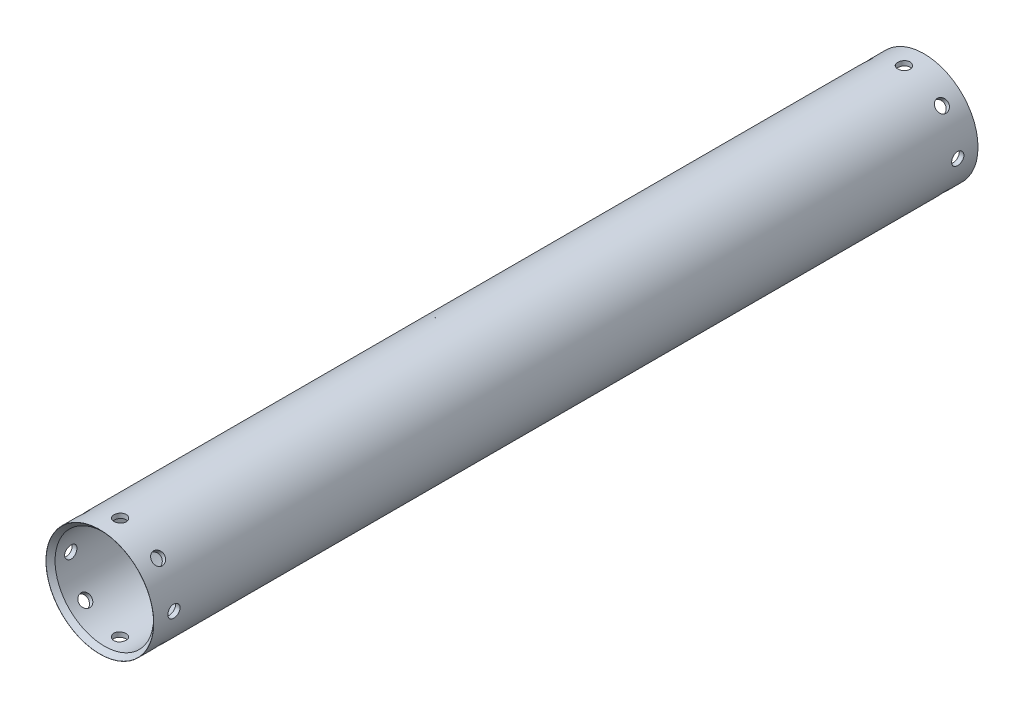
from build123d import *

# Parameters (mm, degrees)
SKETCH1_R               = 38.275
BOSS_EXTRUDE1_DEPTH     = 585
SKETCH2_R               = 34.975
CUT_EXTRUDE1_DEPTH      = 585
CUT_EXTRUDE2_DEPTH      = 588.49889468
CUT_EXTRUDE2_DEPTH_BACK = 588.49889468
SKETCH6_R               = 4.35
CUT_EXTRUDE3_DEPTH      = 588.498894792
CUT_EXTRUDE3_DEPTH_BACK = 588.498894792
SKETCH7_R               = 4.35
CUT_EXTRUDE4_DEPTH      = 588.498894792
CUT_EXTRUDE4_DEPTH_BACK = 588.498894792
SKETCH8_R               = 4.35
CUT_EXTRUDE5_DEPTH      = 588.498894792
CUT_EXTRUDE5_DEPTH_BACK = 588.498894792
SKETCH9_R               = 4.35
CUT_EXTRUDE6_DEPTH      = 593.25290528
CUT_EXTRUDE6_DEPTH_BACK = 593.25290528
SKETCH10_R              = 4.35
CUT_EXTRUDE7_DEPTH      = 593.25290528
CUT_EXTRUDE7_DEPTH_BACK = 593.25290528
SKETCH11_R              = 4.35
CUT_EXTRUDE8_DEPTH      = 585
CUT_EXTRUDE8_DEPTH_BACK = 585
SKETCH12_R              = 4.35
CUT_EXTRUDE9_DEPTH      = 585
CUT_EXTRUDE9_DEPTH_BACK = 585
SKETCH13_R              = 4.35
CHAMFER1_SIZE           = 3.2
CHAMFER2_SIZE           = 3.2


with BuildPart() as part:
    # Sketch1 → Boss-Extrude1 (new body)
    with BuildSketch(Plane.XY):
        Circle(SKETCH1_R)
    extrude(amount=BOSS_EXTRUDE1_DEPTH)

    # Sketch2 → Cut-Extrude1 (cut)
    with BuildSketch(Plane.XY.offset(585)):
        Circle(SKETCH2_R)
    extrude(amount=-CUT_EXTRUDE1_DEPTH, mode=Mode.SUBTRACT)

    # Sketch6 → Cut-Extrude2 (cut, two sides: drawn at the far end of the back side and taken through both)
    with BuildSketch(Plane(origin=(0, 0, 0), x_dir=(1, 0, 0), z_dir=(0, 1, 0)).offset(-CUT_EXTRUDE2_DEPTH_BACK)):
        with Locations((0, -570.65)):
            Circle(SKETCH6_R)
    extrude(amount=CUT_EXTRUDE2_DEPTH + CUT_EXTRUDE2_DEPTH_BACK, mode=Mode.SUBTRACT)

    # Sketch7 → Cut-Extrude3 (cut, two sides: drawn at the far end of the back side and taken through both)
    with BuildSketch(Plane(origin=(0, 0, 0), x_dir=(0, 0, -1), z_dir=(1, 0, 0)).offset(-CUT_EXTRUDE3_DEPTH_BACK)):
        with Locations((-570.65, 0)):
            Circle(SKETCH7_R)
    extrude(amount=CUT_EXTRUDE3_DEPTH + CUT_EXTRUDE3_DEPTH_BACK, mode=Mode.SUBTRACT)

    # Sketch8 → Cut-Extrude4 (cut, two sides: drawn at the far end of the back side and taken through both)
    with BuildSketch(Plane(origin=(0, 0, 0), x_dir=(0, 0, -1), z_dir=(1, 0, 0)).offset(-CUT_EXTRUDE4_DEPTH_BACK)):
        with Locations((-14.35, 0)):
            Circle(SKETCH8_R)
    extrude(amount=CUT_EXTRUDE4_DEPTH + CUT_EXTRUDE4_DEPTH_BACK, mode=Mode.SUBTRACT)

    # Sketch9 → Cut-Extrude5 (cut, two sides: drawn at the far end of the back side and taken through both)
    with BuildSketch(Plane(origin=(0, 0, 0), x_dir=(1, 0, 0), z_dir=(0, 1, 0)).offset(-CUT_EXTRUDE5_DEPTH_BACK)):
        with Locations((0, -14.35)):
            Circle(SKETCH9_R)
    extrude(amount=CUT_EXTRUDE5_DEPTH + CUT_EXTRUDE5_DEPTH_BACK, mode=Mode.SUBTRACT)

    # Sketch10 → Cut-Extrude6 (cut, two sides: drawn at the far end of the back side and taken through both)
    with BuildSketch(Plane(origin=(27.06451205, -27.06451205, 0), x_dir=(0, 0, -1), z_dir=(0.7071067811865464, -0.7071067811865488, 0)).offset(-CUT_EXTRUDE6_DEPTH_BACK)):
        with Locations((-570.65, 0)):
            Circle(SKETCH10_R)
    extrude(amount=CUT_EXTRUDE6_DEPTH + CUT_EXTRUDE6_DEPTH_BACK, mode=Mode.SUBTRACT)

    # Sketch11 → Cut-Extrude7 (cut, two sides: drawn at the far end of the back side and taken through both)
    with BuildSketch(Plane(origin=(27.06451205, -27.06451205, 0), x_dir=(0, 0, -1), z_dir=(0.7071067811865464, -0.7071067811865488, 0)).offset(-CUT_EXTRUDE7_DEPTH_BACK)):
        with Locations((-14.35, 0)):
            Circle(SKETCH11_R)
    extrude(amount=CUT_EXTRUDE7_DEPTH + CUT_EXTRUDE7_DEPTH_BACK, mode=Mode.SUBTRACT)

    # Sketch12 → Cut-Extrude8 (cut, two sides: drawn at the far end of the back side and taken through both)
    with BuildSketch(Plane(origin=(-27.06451205, -27.06451205, 0), x_dir=(0, 0, 1), z_dir=(-0.7071067811865487, -0.7071067811865465, 0)).offset(-CUT_EXTRUDE8_DEPTH_BACK)):
        with Locations((570.65, 0)):
            Circle(SKETCH12_R)
    extrude(amount=CUT_EXTRUDE8_DEPTH + CUT_EXTRUDE8_DEPTH_BACK, mode=Mode.SUBTRACT)

    # Sketch13 → Cut-Extrude9 (cut, two sides: drawn at the far end of the back side and taken through both)
    with BuildSketch(Plane(origin=(-27.06451205, -27.06451205, 0), x_dir=(0, 0, 1), z_dir=(-0.7071067811865487, -0.7071067811865465, 0)).offset(-CUT_EXTRUDE9_DEPTH_BACK)):
        with Locations((14.35, 0)):
            Circle(SKETCH13_R)
    extrude(amount=CUT_EXTRUDE9_DEPTH + CUT_EXTRUDE9_DEPTH_BACK, mode=Mode.SUBTRACT)

    # Chamfer1
    chamfer1_edges = [part.edges().sort_by_distance(p)[0] for p in [
        (-34.975, 0, 585),
    ]]
    chamfer(chamfer1_edges, length=CHAMFER1_SIZE)

    # Chamfer2
    chamfer2_edges = [part.edges().sort_by_distance(p)[0] for p in [
        (-34.975, 0, 0),
    ]]
    chamfer(chamfer2_edges, length=CHAMFER2_SIZE)


solid = part.part
